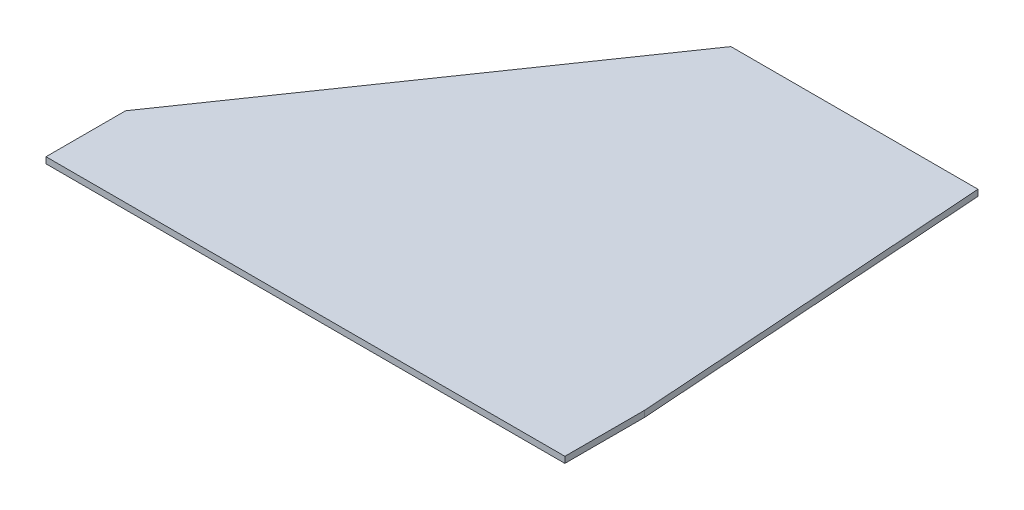
from build123d import *

# Parameters (mm, degrees)
BOSS_EXTRUDE1_DEPTH = 3.175


with BuildPart() as part:
    # Sketch1 → Boss-Extrude1 (new body)
    with BuildSketch(Plane(origin=(0, 0, 0), x_dir=(1, 0, 0), z_dir=(0, 1, 0))):
        Polygon((266.7, 0), (266.7, 40.894), (254, 225.044), (127, 225.044), (0, 40.894), (0, 0), align=None)
    extrude(amount=BOSS_EXTRUDE1_DEPTH)


solid = part.part
